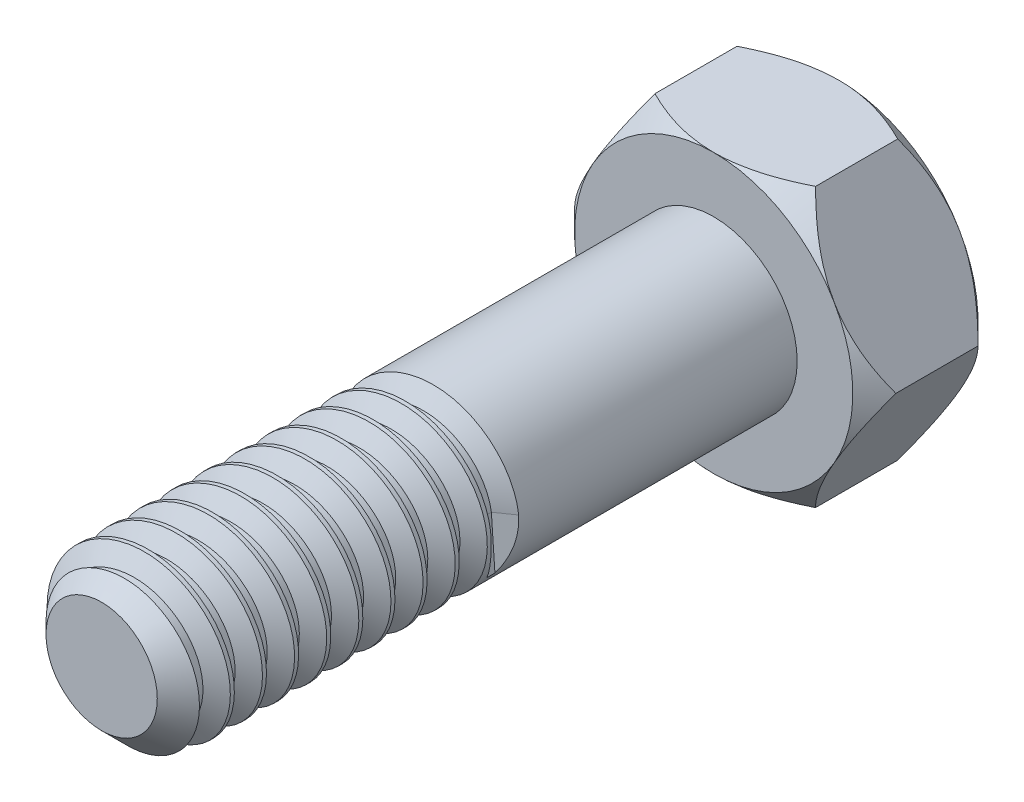
from build123d import *

# Parameters (mm, degrees)
BOSS_EXTRUDE1_DEPTH     = 1.125
SKETCH2_OUTSIDE_W       = 20.232
SKETCH2_OUTSIDE_H       = 19.458
SKETCH2_OUTSIDE_R       = 2.5
CUT_EXTRUDE1_DEPTH      = 5.432362049
CUT_EXTRUDE1_DRAFT      = -45
MIRROR1_COPY_1_SKETCH_W = 20.232
MIRROR1_COPY_1_SKETCH_H = 19.458
MIRROR1_COPY_1_SKETCH_R = 2.5
MIRROR1_COPY_1_DEPTH    = 5.432362049
MIRROR1_COPY_1_DRAFT    = -45
SKETCH3_R               = 1.5
BOSS_EXTRUDE2_DEPTH     = 11
CHAMFER1_SIZE           = 0.5
THREAD1_PITCH           = 0.577272727
CUT_EXTRUDE2_DEPTH      = 13.71215799


with BuildPart() as part:
    # Sketch1 → Boss-Extrude1 (new, symmetric)
    with BuildSketch(Plane.XY):
        Polygon((1.443375673, -2.5), (2.886751346, 0), (1.443375673, 2.5), (-1.443375673, 2.5), (-2.886751346, 0), (-1.443375673, -2.5), align=None)
    extrude(amount=BOSS_EXTRUDE1_DEPTH, both=True)


with BuildPart() as cut_extrude1_tool:
    # Sketch2 outside → Cut-Extrude1 (with draft: the straight prism first)
    with BuildSketch(Plane.XY.offset(1.125)):
        Rectangle(SKETCH2_OUTSIDE_W, SKETCH2_OUTSIDE_H)
        Circle(SKETCH2_OUTSIDE_R, mode=Mode.SUBTRACT)
    extrude(amount=-CUT_EXTRUDE1_DEPTH)
    # Cut-Extrude1: the draft: its side faces are tilted about the plane it starts from
    cut_extrude1_sides = [cut_extrude1_tool.faces().sort_by_distance(p)[0] for p in [
        (0, -9.729, -1.591181024),
        (10.116, 0, -1.591181024),
        (0, 9.729, -1.591181024),
        (-10.116, 0, -1.591181024),
        (-2.5, 0, -1.591181024),
    ]]
    draft(cut_extrude1_sides, Plane.XY.offset(1.125), CUT_EXTRUDE1_DRAFT)


with BuildPart() as part_1:
    add(part.part)

    # Cut-Extrude1: cut by cut_extrude1_tool
    add(cut_extrude1_tool.part, mode=Mode.SUBTRACT)


with BuildPart() as mirror1_copy_1_tool:
    # Mirror1 copy 1 sketch → Mirror1 copy 1 (with draft: the straight prism first)
    with BuildSketch(Plane(origin=(0, 0, -1.125), x_dir=(1, 0, 0), z_dir=(0, 0, -1))):
        Rectangle(MIRROR1_COPY_1_SKETCH_W, MIRROR1_COPY_1_SKETCH_H)
        Circle(MIRROR1_COPY_1_SKETCH_R, mode=Mode.SUBTRACT)
    extrude(amount=-MIRROR1_COPY_1_DEPTH)
    # Mirror1 copy 1: the draft: its side faces are tilted about the plane it starts from
    mirror1_copy_1_sides = [mirror1_copy_1_tool.faces().sort_by_distance(p)[0] for p in [
        (0, -9.729, 1.591181024),
        (10.116, 0, 1.591181024),
        (0, 9.729, 1.591181024),
        (-10.116, 0, 1.591181024),
        (-2.5, 0, 1.591181024),
    ]]
    draft(mirror1_copy_1_sides, Plane(origin=(0, 0, -1.125), x_dir=(1, 0, 0), z_dir=(0, 0, -1)), MIRROR1_COPY_1_DRAFT)


with BuildPart() as part_2:
    add(part_1.part)

    # Mirror1 copy 1: cut by mirror1_copy_1_tool
    add(mirror1_copy_1_tool.part, mode=Mode.SUBTRACT)

    # Sketch3 → Boss-Extrude2 (add)
    with BuildSketch(Plane.XY.offset(1.125)):
        Circle(SKETCH3_R)
    extrude(amount=BOSS_EXTRUDE2_DEPTH)

    # Chamfer1
    chamfer1_edges = [part_2.edges().sort_by_distance(p)[0] for p in [
        (-1.5, 0, 12.125),
    ]]
    chamfer(chamfer1_edges, length=CHAMFER1_SIZE)

    # Thread1: the profile of Thread Profile2 profile screwed along a right-hand helix of 20 turns, 6 arcs to a turn; built about Z, then put on its axis
    thread1_z = Axis((0, 0, 0), (0, 0, 1))
    thread1_corners = [(1.5003, 0, -0.000173205), (1.5003, 0, 0.50528684), (1.187541972, 0, 0.324715908), (1.187541972, 0, 0.180397726)]
    with BuildLine(mode=Mode.PRIVATE) as thread1_profile:
        Line(thread1_corners[0], thread1_corners[1])
        Line(thread1_corners[1], thread1_corners[2])
        Line(thread1_corners[2], thread1_corners[3])
        Line(thread1_corners[3], thread1_corners[0])
    thread1_cap = Face(thread1_profile.wire())
    thread1_turn_angles = [0, 30, 60, 90, 120, 150, 180, 210, 240, 270, 300, 330, 360]
    thread1_turn_weights = [1, 0.8660254037844387, 1, 0.8660254037844387, 1, 0.8660254037844387, 1, 0.8660254037844387, 1, 0.8660254037844387, 1, 0.8660254037844387, 1]
    thread1_turn_rails = [Edge.make_bspline([Vector(p[0], p[1], 0).rotate(thread1_z, thread1_turn_angles[k]) / thread1_turn_weights[k] + Vector(0, 0, p[2] + THREAD1_PITCH * thread1_turn_angles[k] / 360) for k in range(13)], [0, 0, 0, 1, 1, 2, 2, 3, 3, 4, 4, 5, 5, 6, 6, 6], 2, thread1_turn_weights) for p in thread1_corners]
    thread1_turn_sides = [Face.make_surface_from_curves(thread1_turn_rails[p[0]], thread1_turn_rails[p[1]]) for p in [(0, 1), (1, 2), (2, 3), (3, 0)]]
    thread1 = Plane(origin=(0, 0, 6.125), x_dir=(0.99756405, 0.069756474, 0), z_dir=(0, 0, 1)) * Solid(Shell([*[p.moved(Location((0, 0, THREAD1_PITCH * i))) for i in range(20) for p in thread1_turn_sides], thread1_cap, thread1_cap.rotate(thread1_z, 7200).moved(Location((0, 0, THREAD1_PITCH * 7200 / 360)))]))
    add(thread1, mode=Mode.SUBTRACT)

    # Sketch13 → Cut-Extrude2 (cut, through all)
    with BuildSketch(Plane(origin=(0, 0, 0), x_dir=(0.9975640502598243, 0.06975647374412533, 0), z_dir=(-0.06975647374412533, 0.9975640502598243, 0))):
        Polygon((1.5, -6.125), (1.187541972, -6.305397726), (1.187541972, -6.449715908), (1.5, -6.630113635), align=None)
    extrude(amount=-CUT_EXTRUDE2_DEPTH, mode=Mode.SUBTRACT)


solid = part_2.part
